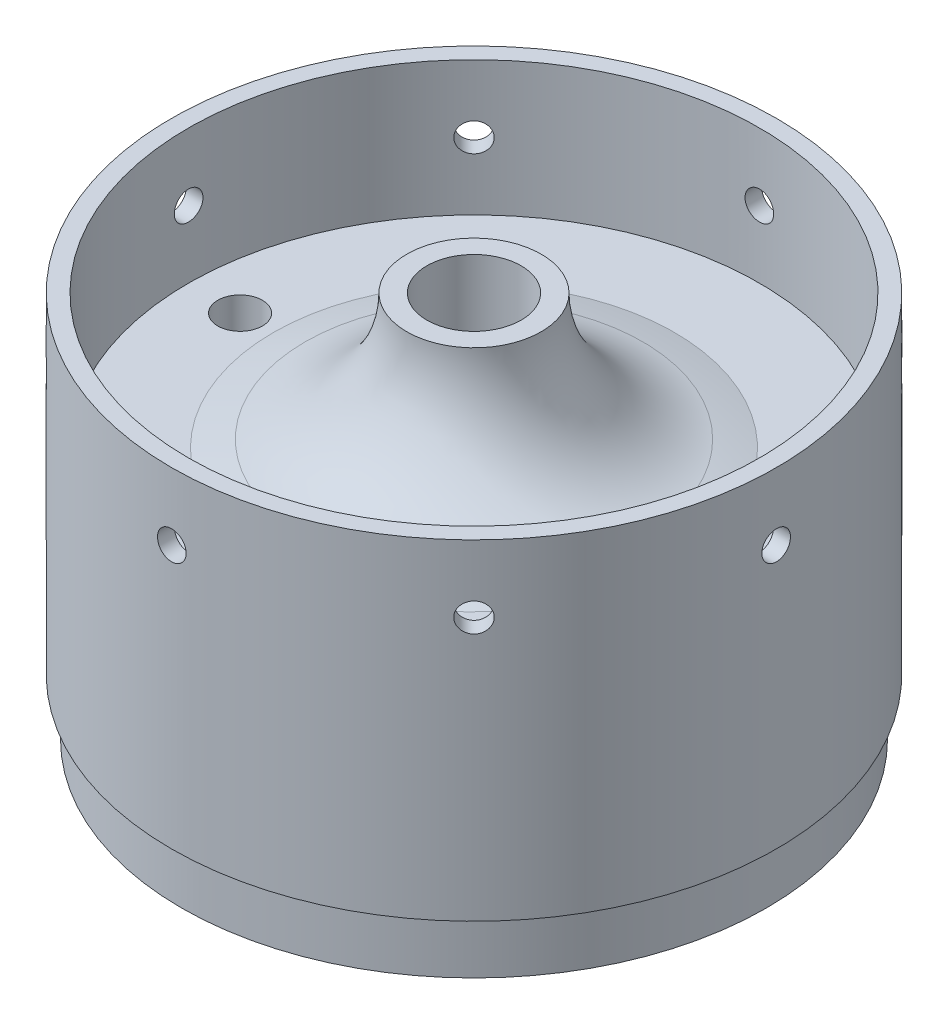
from build123d import *

# Parameters (mm, degrees)
CIRPATTERN1_COUNT        = 8
Q_0_332_DIAMETER_HOLE2_D = 8.4328


with BuildPart() as part:
    # Sketch1 → Revolve2 (revolve)
    with BuildSketch(Plane.XY):
        with BuildLine():
            Line((-57.15, 73.025), (-57.15, 10.624852263))
            Line((-57.15, 10.624852263), (-55.245, 9.525))
            Line((-55.245, 9.525), (-55.245, 0))
            Line((-55.245, 0), (-53.975, 0))
            Line((-53.975, 0), (-53.975, 9.525))
            Line((-53.975, 9.525), (-51.767289196, 22.045550146))
            ThreePointArc((-51.767289196, 22.045550146), (-47.904663261, 33.54538358), (-37.883176964, 40.381746687))
            ThreePointArc((-37.883176964, 40.381746687), (-30.476087003, 42.251547059), (-22.977861009, 43.713648991))
            ThreePointArc((-22.977861009, 43.713648991), (-13.02791329, 47.835052281), (-8.90651, 57.785))
            Line((-8.90651, 57.785), (-8.90651, 73.025))
            Line((-8.90651, 73.025), (-12.7, 73.025))
            ThreePointArc((-12.7, 73.025), (-18.089335197, 57.687867337), (-31.888076613, 49.093258126))
            ThreePointArc((-31.888076613, 49.093258126), (-34.893350397, 48.39066562), (-37.883176964, 47.625))
            Line((-37.883176964, 47.625), (-53.975, 47.625))
            Line((-53.975, 47.625), (-53.975, 73.025))
            Line((-53.975, 73.025), (-57.15, 73.025))
        make_face()
    revolve(axis=Axis((0, 127.060987048, 0), (0, -1, 0)))

    # Sketch5 → #3 (0.213) Diameter Hole1 (revolve, cut)
    with BuildSketch(Plane(origin=(0, 60.325, 57.15), x_dir=(0, -1, 0), z_dir=(1, 0, 0))):
        Polygon((0, 0), (0, 13.309388061), (2.7051, 11.684), (2.7051, 0), align=None)
    f_3_0_213_diameter_hole1 = revolve(axis=Axis((0, 60.325, 63.5), (0, 0, -1)), mode=Mode.SUBTRACT)

    # CirPattern1: #3 (0.213) Diameter Hole1 ×8 about axis
    cirpattern1_axis = Axis((0, 127.060987048, 0), (0, -1, 0))
    for i in range(1, CIRPATTERN1_COUNT):
        add(f_3_0_213_diameter_hole1.rotate(cirpattern1_axis, i * 360 / CIRPATTERN1_COUNT), mode=Mode.SUBTRACT)

    # Q (0.332) Diameter Hole2 (through all)
    with Locations(Plane(origin=(0, 47.625, 0), x_dir=(1, 0, 0), z_dir=(0, 1, 0))):
        with Locations((-44.196, 0)):
            Hole(Q_0_332_DIAMETER_HOLE2_D / 2)


solid = part.part
